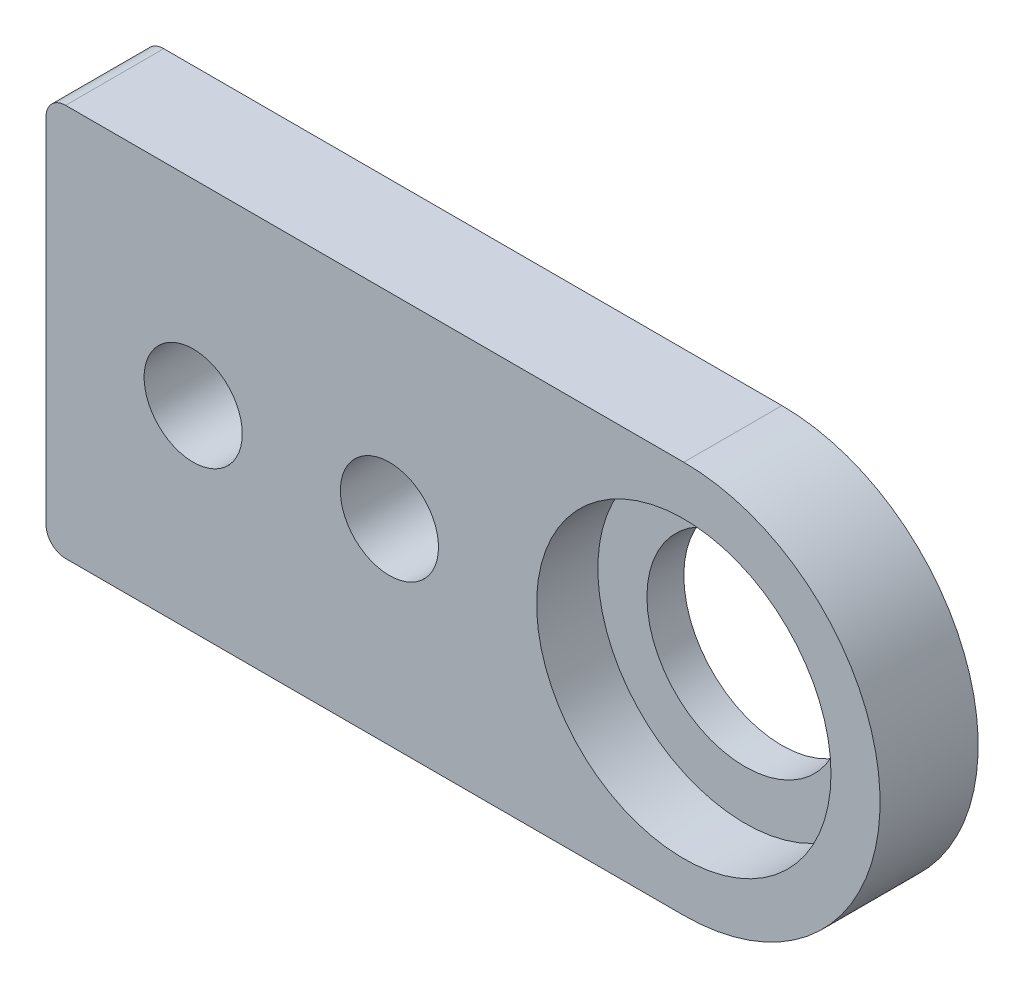
from build123d import *

# Parameters (mm, degrees)
SKETCH1_W           = 53.975
SKETCH1_H           = 25.4
SKETCH1_R           = 9.525
SKETCH1_R_2         = 3.175
BOSS_EXTRUDE2_DEPTH = 6.35
SKETCH1_5_R         = 9.525
SKETCH1_5_R_2       = 6.35
BOSS_EXTRUDE3_DEPTH = 2.3876
FILLET1_R           = 1.27
CUT_EXTRUDE1_DEPTH  = 60.989858518


with BuildPart() as part:
    # Sketch1 → Boss-Extrude2 (new body)
    with BuildSketch(Plane.XY):
        with Locations((26.9875, -12.7)):
            Rectangle(SKETCH1_W, SKETCH1_H)
        with Locations((41.275, -12.7)):
            Circle(SKETCH1_R, mode=Mode.SUBTRACT)
        with Locations((22.225, -12.7)):
            Circle(SKETCH1_R_2, mode=Mode.SUBTRACT)
        with Locations((9.525, -12.7)):
            Circle(SKETCH1_R_2, mode=Mode.SUBTRACT)
    extrude(amount=BOSS_EXTRUDE2_DEPTH)

    # Sketch1<5> → Boss-Extrude3 (add)
    with BuildSketch(Plane.XY):
        with Locations((41.275, -12.7)):
            Circle(SKETCH1_5_R)
        with Locations((41.275, -12.7)):
            Circle(SKETCH1_5_R_2, mode=Mode.SUBTRACT)
    extrude(amount=BOSS_EXTRUDE3_DEPTH)

    # Fillet1
    fillet1_edges = [part.edges().sort_by_distance(p)[0] for p in [
        (0, -25.4, 3.175),
        (0, 0, 3.175),
        (53.975, -25.4, 3.175),
        (53.975, 0, 3.175),
    ]]
    fillet(fillet1_edges, radius=FILLET1_R)

    # Sketch2 → Cut-Extrude1 (cut, through all)
    with BuildSketch(Plane.XY.offset(6.35)):
        with BuildLine():
            Line((41.275, -25.4), (52.705, -25.4))
            ThreePointArc((52.705, -25.4), (53.603025612, -25.028025612), (53.975, -24.13))
            Line((53.975, -24.13), (53.975, -12.7))
            ThreePointArc((53.975, -12.7), (50.255256121, -21.680256121), (41.275, -25.4))
        make_face()
        with BuildLine():
            ThreePointArc((41.275, 0), (50.255256121, -3.719743879), (53.975, -12.7))
            Line((53.975, -12.7), (53.975, -1.27))
            ThreePointArc((53.975, -1.27), (53.603025612, -0.371974388), (52.705, 0))
            Line((52.705, 0), (41.275, 0))
        make_face()
    extrude(amount=-CUT_EXTRUDE1_DEPTH, mode=Mode.SUBTRACT)


solid = part.part
